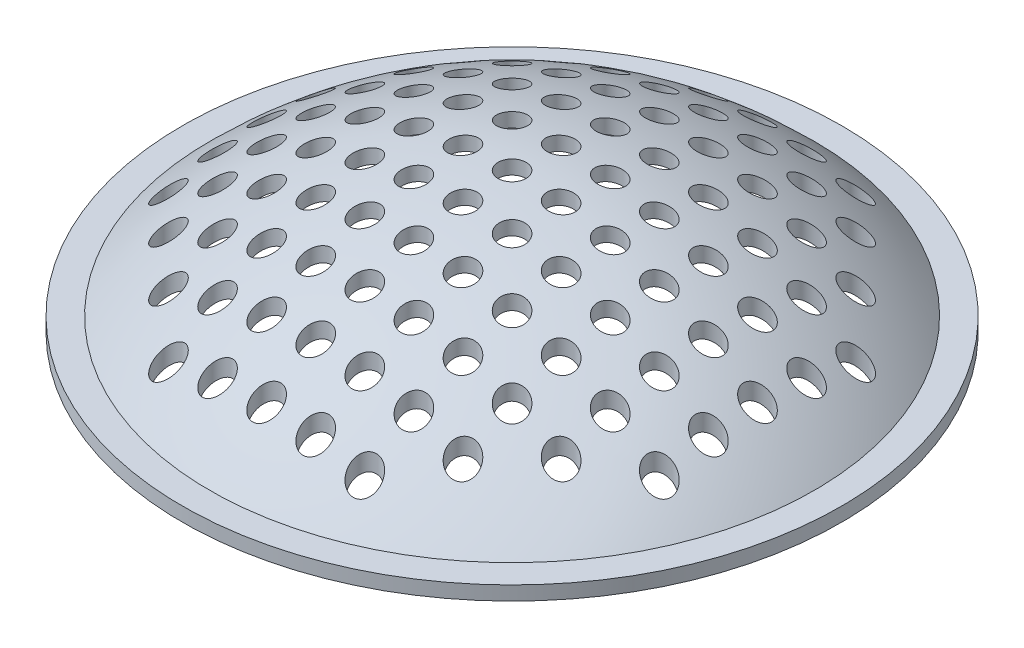
from build123d import *

# Parameters (mm, degrees)
SKETCH_2_R               = 2350
EXTRUDE_1_DEPTH          = 100
SKETCH_3_R               = 100
CUT_EXTRUDE_1_DEPTH      = 3471.590727816
PATTERN_CIRCULAR_1_COUNT = 4


# Read off the part's stored shape, not the designer's step: ｼｪﾙ1
with BuildPart() as part:
    # ｽｹｯﾁ1 → 回転1 (revolve)
    with BuildSketch(Plane.XY):
        with BuildLine():
            Line((0, 1000), (0, 0))
            Line((0, 0), (2250, 0))
            ThreePointArc((2250, 0), (1231.107225225, 738.741256755), (0, 1000))
        make_face()
    revolve(axis=Axis((0, 1000, 0), (0, -1, 0)))

    # ｽｹｯﾁ2 → ﾎﾞｽ - 押し出し1 (add)
    with BuildSketch(Plane.XZ):
        with Locations(Location((0, 0, 0), (0, 0, 270))):
            Circle(SKETCH_2_R)
    extrude(amount=-EXTRUDE_1_DEPTH)

    # ｼｪﾙ1 outline → ｼｪﾙ1 (revolve, cut)
    with BuildSketch(Plane.XY):
        with BuildLine():
            Line((0, -1e-07), (2113.350420637, -1e-07))
            ThreePointArc((2113.350420637, -1e-07), (1148.504462397, 665.630431601), (0, 900))
            Line((0, 900), (0, -1e-07))
        make_face()
    revolve(axis=Axis((0, 0, 0), (0, 1, 0)), mode=Mode.SUBTRACT)

    # ｽｹｯﾁ3 → ｶｯﾄ - 押し出し1 (cut, through all)
    with BuildSketch(Plane(origin=(0, 0, 0), x_dir=(1, 0, 0), z_dir=(0, 1, 0))):
        with Locations(Location((0, 0, 0), (0, 0, 90))):
            Circle(SKETCH_3_R)
        with Locations(Location((350, 0, 0), (0, 0, 145.719670615))):
            Circle(SKETCH_3_R)
        with Locations(Location((700, 0, 0), (0, 0, 133.402491797))):
            Circle(SKETCH_3_R)
        with Locations(Location((1050, 0, 0), (0, 0, 30.757638582))):
            Circle(SKETCH_3_R)
        with Locations(Location((1400, 0, 0), (0, 0, 106.991678977))):
            Circle(SKETCH_3_R)
        with Locations(Location((1750, 0, 0), (0, 0, 105.783762421))):
            Circle(SKETCH_3_R)
        with Locations(Location((350, 350, 0), (0, 0, 136.306999935))):
            Circle(SKETCH_3_R)
        with Locations(Location((700, 350, 0), (0, 0, 128.709358696))):
            Circle(SKETCH_3_R)
        with Locations(Location((1050, 350, 0), (0, 0, 108.606606358))):
            Circle(SKETCH_3_R)
        with Locations(Location((1400, 350, 0), (0, 0, 139.468328689))):
            Circle(SKETCH_3_R)
        with Locations(Location((1750, 350, 0), (0, 0, 109.613949896))):
            Circle(SKETCH_3_R)
        with Locations(Location((350, 700, 0), (0, 0, 131.381543246))):
            Circle(SKETCH_3_R)
        with Locations(Location((700, 700, 0), (0, 0, 130.106623634))):
            Circle(SKETCH_3_R)
        with Locations(Location((1050, 700, 0), (0, 0, 43.281363893))):
            Circle(SKETCH_3_R)
        with Locations(Location((1400, 700, 0), (0, 0, 100.383193419))):
            Circle(SKETCH_3_R)
        with Locations(Location((1750, 700, 0), (0, 0, 97.620916758))):
            Circle(SKETCH_3_R)
        with Locations(Location((350, 1050, 0), (0, 0, 120.767458124))):
            Circle(SKETCH_3_R)
        with Locations(Location((700, 1050, 0), (0, 0, 69.312926168))):
            Circle(SKETCH_3_R)
        with Locations(Location((1050, 1050, 0), (0, 0, 68.88826301))):
            Circle(SKETCH_3_R)
        with Locations(Location((1400, 1050, 0), (0, 0, 123.524290805))):
            Circle(SKETCH_3_R)
        with Locations(Location((350, 1400, 0), (0, 0, 61.019624204))):
            Circle(SKETCH_3_R)
        with Locations(Location((700, 1400, 0), (0, 0, 101.046937908))):
            Circle(SKETCH_3_R)
        with Locations(Location((1050, 1400, 0), (0, 0, 128.889726609))):
            Circle(SKETCH_3_R)
        with Locations(Location((350, 1750, 0), (0, 0, 113.571862869))):
            Circle(SKETCH_3_R)
        with Locations(Location((700, 1750, 0), (0, 0, 99.275157402))):
            Circle(SKETCH_3_R)
        with Locations(Location((0, 350, 0), (0, 0, 269.999999999))):
            Circle(SKETCH_3_R)
        with Locations(Location((0, 700, 0), (0, 0, 269.999999998))):
            Circle(SKETCH_3_R)
        with Locations(Location((0, 1050, 0), (0, 0, 90))):
            Circle(SKETCH_3_R)
        with Locations(Location((0, 1400, 0), (0, 0, 90))):
            Circle(SKETCH_3_R)
        with Locations(Location((0, 1750, 0), (0, 0, 90))):
            Circle(SKETCH_3_R)
    cut_extrude_1 = extrude(amount=CUT_EXTRUDE_1_DEPTH, mode=Mode.SUBTRACT)

    # 円形ﾊﾟﾀｰﾝ1: ｶｯﾄ - 押し出し1 ×4 about axis
    pattern_circular_1_axis = Axis((0, 0, 0), (0, 1, 0))
    for i in range(1, PATTERN_CIRCULAR_1_COUNT):
        add(cut_extrude_1.rotate(pattern_circular_1_axis, i * 360 / PATTERN_CIRCULAR_1_COUNT), mode=Mode.SUBTRACT)


solid = part.part
